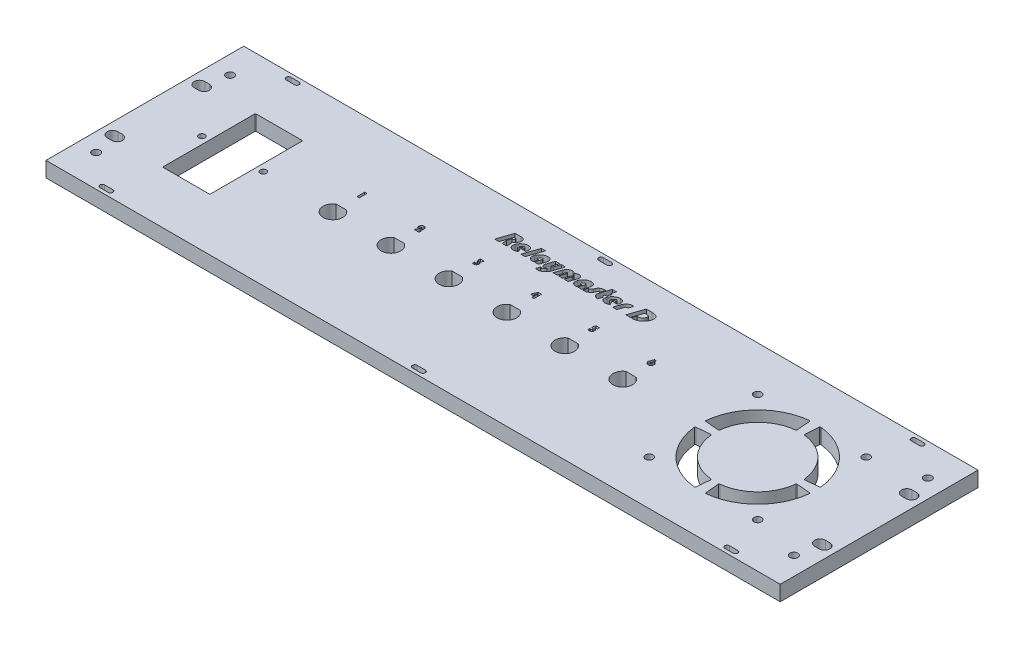
from build123d import *

# Parameters (mm, degrees)
SKETCH1_W           = 482.6
SKETCH1_H           = 130
SKETCH1_R           = 2.5527
BOSS_EXTRUDE1_DEPTH = 10
CUT_EXTRUDE2_DEPTH  = 407.159250458
SKETCH3_R           = 2
SKETCH3_W           = 31
SKETCH3_H           = 61
CUT_EXTRUDE3_DEPTH  = 407.159250576
FILLET1_R           = 0.5
SKETCH4_R           = 2.5
CUT_EXTRUDE4_DEPTH  = 407.159250576
FILLET2_R           = 0.5
CUT_EXTRUDE5_DEPTH  = 10
LPATTERN1_COUNT     = 6
LPATTERN1_PITCH     = 38.1
SKETCH6_W           = 1.458333334
SKETCH6_H           = 5
CUT_EXTRUDE6_DEPTH  = 407.159250576
CUT_EXTRUDE7_DEPTH  = 407.159250576
LPATTERN2_COUNT     = 2
LPATTERN2_PITCH     = 205.4
LPATTERN3_COUNT     = 2
LPATTERN3_PITCH     = 205.4


with BuildPart() as part:
    # Sketch1 → Boss-Extrude1 (new body)
    with BuildSketch(Plane(origin=(0, 0, 0), x_dir=(1, 0, 0), z_dir=(0, 1, 0))):
        with Locations((158.999180011, 3.013992786)):
            Rectangle(SKETCH1_W, SKETCH1_H)
        with Locations((-70.300819989, 47.013992786)):
            Circle(SKETCH1_R, mode=Mode.SUBTRACT)
        with Locations((-70.300819989, -40.986007214)):
            Circle(SKETCH1_R, mode=Mode.SUBTRACT)
        with Locations((388.299180011, -40.986007214)):
            Circle(SKETCH1_R, mode=Mode.SUBTRACT)
        with Locations((388.299180011, 47.013992786)):
            Circle(SKETCH1_R, mode=Mode.SUBTRACT)
        with BuildLine():
            Line((-75.000819989, 35.088992786), (-72.000819989, 35.088992786))
            ThreePointArc((-72.000819989, 35.088992786), (-68.500819989, 31.588992786), (-72.000819989, 28.088992786))
            Line((-72.000819989, 28.088992786), (-75.000819989, 28.088992786))
            ThreePointArc((-75.000819989, 28.088992786), (-78.500819989, 31.588992786), (-75.000819989, 35.088992786))
        make_face(mode=Mode.SUBTRACT)
        with BuildLine():
            Line((-75.000819989, -22.061007214), (-72.000819989, -22.061007214))
            ThreePointArc((-72.000819989, -22.061007214), (-68.500819989, -25.561007214), (-72.000819989, -29.061007214))
            Line((-72.000819989, -29.061007214), (-75.000819989, -29.061007214))
            ThreePointArc((-75.000819989, -29.061007214), (-78.500819989, -25.561007214), (-75.000819989, -22.061007214))
        make_face(mode=Mode.SUBTRACT)
        with BuildLine():
            Line((392.999180011, 28.088992786), (389.999180011, 28.088992786))
            ThreePointArc((389.999180011, 28.088992786), (386.499180011, 31.588992786), (389.999180011, 35.088992786))
            Line((389.999180011, 35.088992786), (392.999180011, 35.088992786))
            ThreePointArc((392.999180011, 35.088992786), (396.499180011, 31.588992786), (392.999180011, 28.088992786))
        make_face(mode=Mode.SUBTRACT)
        with BuildLine():
            Line((392.999180011, -29.061007214), (389.999180011, -29.061007214))
            ThreePointArc((389.999180011, -29.061007214), (386.499180011, -25.561007214), (389.999180011, -22.061007214))
            Line((389.999180011, -22.061007214), (392.999180011, -22.061007214))
            ThreePointArc((392.999180011, -22.061007214), (396.499180011, -25.561007214), (392.999180011, -29.061007214))
        make_face(mode=Mode.SUBTRACT)
    extrude(amount=BOSS_EXTRUDE1_DEPTH)

    # Sketch2 → Cut-Extrude2 (cut, through all)
    with BuildSketch(Plane(origin=(0, 10, 0), x_dir=(1, 0, 0), z_dir=(0, 1, 0))):
        with BuildLine():
            Line((115.335548963, 47.892597993), (112.88112188, 40.670375771))
            Line((112.88112188, 40.670375771), (109.964455213, 40.670375771))
            Line((109.964455213, 40.670375771), (113.362892713, 50.670375771))
            Line((113.362892713, 50.670375771), (117.238760769, 50.670375771))
            add(Edge.make_bspline(
                [(117.238760769, 50.670375771), (117.378488132, 50.66829828), (117.647033186, 50.664305505), (118.032383194, 50.622395907), (118.384034766, 50.556106218), (118.703397593, 50.463941844), (118.989470951, 50.342718773), (119.24243641, 50.19399272), (119.463573048, 50.018796041), (119.582453092, 49.878197324), (119.641104519, 49.808830632)],
                knots=[0, 0, 0, 0, 1.268946959, 2.438816719, 3.516291673, 4.516504795, 5.452755853, 6.33073326, 7.176439771, 8, 8, 8, 8], degree=3))
            add(Edge.make_bspline(
                [(119.641104519, 49.808830632), (119.699587482, 49.728059333), (119.815497833, 49.567974599), (119.940169757, 49.297913336), (120.030331769, 49.014477201), (120.080789399, 48.714181217), (120.087163726, 48.398352863), (120.058501635, 48.067327276), (119.990585038, 47.719606274), (119.917613523, 47.487590833), (119.879819797, 47.367424382)],
                knots=[0, 0, 0, 0, 0.932249006, 1.847671586, 2.771408984, 3.712800187, 4.689011787, 5.722820456, 6.820593216, 8, 8, 8, 8], degree=3))
            add(Edge.make_bspline(
                [(119.879819797, 47.367424382), (119.833154617, 47.242640155), (119.73998991, 46.993514658), (119.553958798, 46.637392928), (119.334324356, 46.296255789), (119.079127949, 45.968930566), (118.78594183, 45.657949303), (118.458228568, 45.360912296), (118.093564888, 45.0791406), (117.831047228, 44.908966444), (117.696660074, 44.821851465)],
                knots=[0, 0, 0, 0, 0.933827764, 1.864340643, 2.811651759, 3.77699005, 4.771445029, 5.806065946, 6.876888697, 8, 8, 8, 8], degree=3))
            Line((117.696660074, 44.821851465), (118.000479519, 40.670375771))
            Line((118.000479519, 40.670375771), (114.879819797, 40.670375771))
            Line((114.879819797, 40.670375771), (114.539107991, 43.91473341))
            Line((114.539107991, 43.91473341), (115.42018438, 46.503709104))
            Line((115.42018438, 46.503709104), (115.65455938, 46.503709104))
            add(Edge.make_bspline(
                [(115.65455938, 46.503709104), (115.734971548, 46.505495396), (115.889388907, 46.508925654), (116.109255254, 46.54293042), (116.305300414, 46.602372599), (116.479184767, 46.681114562), (116.62723646, 46.787460897), (116.750966962, 46.916259013), (116.85384571, 47.067291832), (116.897440132, 47.182563833), (116.919750352, 47.241556327)],
                knots=[0, 0, 0, 0, 1.223524833, 2.349563247, 3.373699419, 4.334298088, 5.241868773, 6.129650763, 7.042815567, 8, 8, 8, 8], degree=3))
            add(Edge.make_bspline(
                [(116.919750352, 47.241556327), (116.934777382, 47.291682787), (116.96261298, 47.384535466), (116.951585407, 47.524880574), (116.89732647, 47.646143738), (116.792814469, 47.740167427), (116.648948346, 47.811035287), (116.462837151, 47.857858322), (116.235649041, 47.887282053), (116.069892532, 47.890729859), (115.980080213, 47.892597993)],
                knots=[0, 0, 0, 0, 0.898624187, 1.664583208, 2.38131814, 3.142559736, 4.043707542, 5.133639638, 6.446911837, 8, 8, 8, 8], degree=3))
            Line((115.980080213, 47.892597993), (115.335548963, 47.892597993))
        make_face()
        with BuildLine():
            Line((127.08034063, 43.864820215), (122.928864935, 43.864820215))
            add(Edge.make_bspline(
                [(122.928864935, 43.864820215), (122.941416881, 43.962312226), (122.965754006, 44.151340708), (123.019854456, 44.334063129), (123.046052435, 44.42254591)],
                knots=[0, 0, 0, 0, 1.031506037, 2, 2, 2, 2], degree=3))
            add(Edge.make_bspline(
                [(123.046052435, 44.42254591), (123.090855315, 44.540828871), (123.182631693, 44.783125392), (123.320526452, 45.002525583), (123.391104519, 45.114820215)],
                knots=[0, 0, 0, 0, 0.976348819, 2, 2, 2, 2], degree=3))
            Line((123.391104519, 45.114820215), (124.782163547, 45.114820215))
            add(Edge.make_bspline(
                [(124.782163547, 45.114820215), (124.794125549, 45.190555028), (124.816364301, 45.331354834), (124.820854111, 45.531171801), (124.793971278, 45.701662984), (124.738371102, 45.844500806), (124.64770514, 45.956620204), (124.524334681, 46.034533211), (124.372169651, 46.079911288), (124.261662272, 46.084562352), (124.202736463, 46.087042438)],
                knots=[0, 0, 0, 0, 1.359693728, 2.52782843, 3.530177573, 4.404996503, 5.216909677, 6.042905647, 6.95641929, 8, 8, 8, 8], degree=3))
            add(Edge.make_bspline(
                [(124.202736463, 46.087042438), (124.118193946, 46.08130003), (123.946617115, 46.069645964), (123.694243041, 45.98197496), (123.450590766, 45.837939098), (123.215080686, 45.646292226), (122.997634436, 45.410280729), (122.806729307, 45.138945992), (122.641283655, 44.838221078), (122.560133535, 44.620494666), (122.518708685, 44.509351465)],
                knots=[0, 0, 0, 0, 0.827832751, 1.680064964, 2.58876647, 3.592266134, 4.646151931, 5.724523089, 6.838433137, 8, 8, 8, 8], degree=3))
            add(Edge.make_bspline(
                [(122.518708685, 44.509351465), (122.483339164, 44.39509878), (122.417212985, 44.18149415), (122.365590101, 43.868754192), (122.368927442, 43.589813158), (122.409068136, 43.379255472), (122.472460702, 43.236894832), (122.526284729, 43.143326768), (122.593203099, 43.065165826), (122.672675932, 43.002459843), (122.76097664, 42.95240462), (122.861064326, 42.91800648), (122.970519006, 42.895296046), (123.047374853, 42.893520178), (123.087285074, 42.892597993)],
                knots=[0, 0, 0, 0, 2.100659137, 3.927352035, 5.54202328, 6.985703129, 7.651739151, 8.273086743, 8.877024698, 9.446816915, 10.044433555, 10.651574031, 11.299780288, 12, 12, 12, 12], degree=3))
            add(Edge.make_bspline(
                [(123.087285074, 42.892597993), (123.157992575, 42.896846389), (123.305307183, 42.905697653), (123.527147225, 42.981170691), (123.761975886, 43.088670137), (123.912576788, 43.190369443), (123.992232991, 43.244160493)],
                knots=[0, 0, 0, 0, 0.859384503, 1.790473304, 2.831331656, 4, 4, 4, 4], degree=3))
            Line((123.992232991, 43.244160493), (124.918882297, 41.377841049))
            add(Edge.make_bspline(
                [(124.918882297, 41.377841049), (124.805303666, 41.310728523), (124.581406324, 41.178429727), (124.239470938, 41.005695243), (123.899490712, 40.858075685), (123.55930414, 40.741558557), (123.221125601, 40.647379427), (122.884034174, 40.579476505), (122.548630924, 40.539259758), (122.325670825, 40.534066996), (122.214889241, 40.531486882)],
                knots=[0, 0, 0, 0, 1.103083133, 2.174505721, 3.201645937, 4.200367129, 5.179341595, 6.135640026, 7.073660477, 8, 8, 8, 8], degree=3))
            add(Edge.make_bspline(
                [(122.214889241, 40.531486882), (122.08447934, 40.534542961), (121.831239059, 40.540477496), (121.46563732, 40.594130465), (121.126911628, 40.67645059), (120.81666703, 40.797954249), (120.532881795, 40.951084527), (120.278020994, 41.142371642), (120.053394583, 41.368839763), (119.856039792, 41.623968412), (119.693107858, 41.905425347), (119.571628364, 42.207548617), (119.487556662, 42.524586226), (119.448505815, 42.858099669), (119.442540147, 43.207624328), (119.485056147, 43.573147197), (119.562475159, 43.95478481), (119.643015599, 44.209077619), (119.684507297, 44.340080632)],
                knots=[0, 0, 0, 0, 1.131220035, 2.196692713, 3.200169955, 4.150382372, 5.080363814, 5.990725719, 6.905256434, 7.84081604, 8.783092785, 9.718125583, 10.65923029, 11.620967352, 12.625583103, 13.686384095, 14.808103719, 16, 16, 16, 16], degree=3))
            add(Edge.make_bspline(
                [(119.684507297, 44.340080632), (119.733155835, 44.472535163), (119.830125559, 44.736552946), (120.010903896, 45.11782135), (120.22536001, 45.480668303), (120.466831402, 45.828883941), (120.736861267, 46.162351996), (121.037639597, 46.479617852), (121.367860315, 46.781926048), (121.725988902, 47.062963718), (122.098942762, 47.320761063), (122.480157748, 47.54881461), (122.866600262, 47.739415146), (123.257139225, 47.897666728), (123.652283458, 48.019047922), (124.051420184, 48.106259338), (124.454426572, 48.160406735), (124.724851489, 48.167049081), (124.860288547, 48.170375771)],
                knots=[0, 0, 0, 0, 0.990392726, 1.974121168, 2.95757423, 3.946624651, 4.946878979, 5.967240611, 7.013379789, 8.087405977, 9.160939677, 10.194875671, 11.203387311, 12.183319209, 13.150466102, 14.101868051, 15.049357545, 16, 16, 16, 16], degree=3))
            add(Edge.make_bspline(
                [(124.860288547, 48.170375771), (124.989195588, 48.167003668), (125.23862877, 48.1604787), (125.599393998, 48.111487389), (125.931153197, 48.024075122), (126.236694853, 47.904867463), (126.513843985, 47.74969987), (126.765368016, 47.561719056), (126.985108142, 47.335554054), (127.175112098, 47.079561889), (127.334231451, 46.800275749), (127.453722842, 46.500766121), (127.535740598, 46.185138669), (127.572343683, 45.85303417), (127.575816123, 45.505771847), (127.533222764, 45.144147586), (127.458770539, 44.765643518), (127.378112369, 44.513715051), (127.336417019, 44.38348341)],
                knots=[0, 0, 0, 0, 1.131233226, 2.188919233, 3.186797597, 4.135858022, 5.059607904, 5.966224945, 6.882086875, 7.816638679, 8.757680654, 9.694945741, 10.638874518, 11.610640238, 12.620124796, 13.680208972, 14.800809634, 16, 16, 16, 16], degree=3))
            add(Edge.make_bspline(
                [(127.336417019, 44.38348341), (127.324471304, 44.352230352), (127.297152142, 44.280756408), (127.241258667, 44.163046447), (127.168061661, 44.021253826), (127.111065975, 43.919612967), (127.08034063, 43.864820215)],
                knots=[0, 0, 0, 0, 0.693176941, 1.585255743, 2.698254966, 4, 4, 4, 4], degree=3))
        make_face()
        Polygon((133.362892713, 50.670375771), (129.964455213, 40.670375771), (127.186677435, 40.670375771), (130.585114935, 50.670375771), align=None)
        with BuildLine():
            Line((136.457510769, 43.430792438), (135.487458685, 40.577059799))
            add(Edge.make_bspline(
                [(135.487458685, 40.577059799), (135.376921787, 40.563499792), (135.168596739, 40.537943718), (134.95877789, 40.533549525), (134.860288547, 40.531486882)],
                knots=[0, 0, 0, 0, 1.061196419, 2, 2, 2, 2], degree=3))
            add(Edge.make_bspline(
                [(134.860288547, 40.531486882), (134.727764931, 40.534833429), (134.471845778, 40.541296016), (134.101775461, 40.59043496), (133.761323697, 40.677711477), (133.448353472, 40.796934777), (133.162950569, 40.949536686), (132.906481501, 41.137322021), (132.68075858, 41.361871633), (132.486848438, 41.617307619), (132.325384425, 41.897723493), (132.203294986, 42.198508148), (132.122557852, 42.517663341), (132.08223896, 42.85300907), (132.080233177, 43.205447238), (132.121122706, 43.574076506), (132.201941594, 43.959771473), (132.283472842, 44.217743734), (132.325566324, 44.350931327)],
                knots=[0, 0, 0, 0, 1.144190407, 2.209570271, 3.21553817, 4.172569541, 5.094845463, 6.001870815, 6.907346212, 7.834348322, 8.763305581, 9.693584961, 10.628341389, 11.597586927, 12.603283284, 13.664902594, 14.794420756, 16, 16, 16, 16], degree=3))
            add(Edge.make_bspline(
                [(132.325566324, 44.350931327), (132.37398375, 44.482791321), (132.470273648, 44.745027187), (132.654095009, 45.121634423), (132.860458487, 45.486133354), (133.104678391, 45.831029956), (133.372661197, 46.163933582), (133.672890571, 46.479601096), (134.000019509, 46.78209882), (134.355989664, 47.062159765), (134.724998964, 47.321477753), (135.103475542, 47.548076548), (135.485817158, 47.739555998), (135.870951496, 47.896735612), (136.258486598, 48.019127059), (136.649023989, 48.106214447), (137.043366341, 48.160414346), (137.308035459, 48.167051724), (137.440583685, 48.170375771)],
                knots=[0, 0, 0, 0, 0.994917965, 1.97863784, 2.96618437, 3.960322707, 4.96997828, 5.992682734, 7.044876782, 8.124977746, 9.200176396, 10.239426291, 11.248235466, 12.227872304, 13.184528156, 14.124848425, 15.060910407, 16, 16, 16, 16], degree=3))
            add(Edge.make_bspline(
                [(137.440583685, 48.170375771), (137.583201753, 48.166841028), (137.857710374, 48.160037421), (138.252190324, 48.114078302), (138.61101029, 48.030477682), (138.937581704, 47.919787908), (139.2291217, 47.771177748), (139.485433798, 47.589607564), (139.709095397, 47.376806567), (139.892569309, 47.129765156), (140.042783005, 46.856699712), (140.147755803, 46.556447872), (140.216240252, 46.233436114), (140.240039977, 45.886931288), (140.225765332, 45.516894321), (140.172703802, 45.123891923), (140.078360059, 44.706527517), (139.987729028, 44.425502898), (139.940583685, 44.279316743)],
                knots=[0, 0, 0, 0, 1.196225853, 2.302473407, 3.323857472, 4.281343462, 5.187635444, 6.057979036, 6.907605345, 7.765509949, 8.628868004, 9.511642107, 10.423138458, 11.390568647, 12.416573448, 13.524350622, 14.712192315, 16, 16, 16, 16], degree=3))
            Line((139.940583685, 44.279316743), (138.714455213, 40.670375771))
            Line((138.714455213, 40.670375771), (135.936677435, 40.670375771))
            Line((135.936677435, 40.670375771), (137.095531602, 44.081834104))
            add(Edge.make_bspline(
                [(137.095531602, 44.081834104), (137.125372293, 44.175865751), (137.181071117, 44.35137952), (137.214182532, 44.608869329), (137.207476549, 44.837386602), (137.151188997, 45.034553405), (137.053506738, 45.19883364), (136.905887845, 45.31340088), (136.720887111, 45.38377354), (136.584807751, 45.389515743), (136.511764241, 45.392597993)],
                knots=[0, 0, 0, 0, 1.35465714, 2.52852086, 3.55473976, 4.477449583, 5.322396048, 6.136784919, 6.999879412, 8, 8, 8, 8], degree=3))
            add(Edge.make_bspline(
                [(136.511764241, 45.392597993), (136.440487272, 45.388725027), (136.295587453, 45.380851627), (136.080580816, 45.318593165), (135.867494597, 45.218862424), (135.662406979, 45.083372712), (135.471171907, 44.925914153), (135.313760861, 44.743956051), (135.183406645, 44.551882685), (135.128343188, 44.410058863), (135.101173963, 44.340080632)],
                knots=[0, 0, 0, 0, 0.917738553, 1.865681891, 2.862849718, 3.941460506, 5.026822724, 6.04444962, 7.03509894, 8, 8, 8, 8], degree=3))
            add(Edge.make_bspline(
                [(135.101173963, 44.340080632), (135.079429116, 44.269090589), (135.038522158, 44.135542317), (135.024703801, 43.936360387), (135.051527715, 43.755223054), (135.1245927, 43.597450478), (135.233579928, 43.464897699), (135.382697934, 43.375394635), (135.558300582, 43.316048654), (135.686559564, 43.311611255), (135.754385769, 43.30926466)],
                knots=[0, 0, 0, 0, 1.198022138, 2.253749655, 3.202377793, 4.129386931, 5.034563436, 5.934046712, 6.907477906, 8, 8, 8, 8], degree=3))
            add(Edge.make_bspline(
                [(135.754385769, 43.30926466), (135.873139025, 43.314497292), (136.112669262, 43.325051729), (136.34191798, 43.395347565), (136.457510769, 43.430792438)],
                knots=[0, 0, 0, 0, 0.991551279, 2, 2, 2, 2], degree=3))
        make_face()
        with BuildLine():
            Line((140.148917019, 37.532354938), (140.943187852, 39.869594521))
            add(Edge.make_bspline(
                [(140.943187852, 39.869594521), (141.02013581, 39.842699809), (141.169370442, 39.790539589), (141.393812069, 39.740560627), (141.607549569, 39.704647105), (141.747447398, 39.700280348), (141.815583685, 39.698153549)],
                knots=[0, 0, 0, 0, 1.094028368, 2.121783671, 3.0852275, 4, 4, 4, 4], degree=3))
            add(Edge.make_bspline(
                [(141.815583685, 39.698153549), (141.920143567, 39.701998741), (142.127157041, 39.709611665), (142.429761674, 39.780573707), (142.719904479, 39.891426296), (142.995136374, 40.05065303), (143.257970651, 40.253214536), (143.507164917, 40.499965332), (143.743703696, 40.791081659), (143.881619475, 41.008807831), (143.953170491, 41.12176466)],
                knots=[0, 0, 0, 0, 0.930598492, 1.842450686, 2.754758579, 3.690345955, 4.665181319, 5.704602894, 6.809142816, 8, 8, 8, 8], degree=3))
            add(Edge.make_bspline(
                [(143.953170491, 41.12176466), (143.814112857, 41.052953927), (143.549029445, 40.921781094), (143.149545971, 40.780536939), (142.77318422, 40.688423973), (142.527854899, 40.676225717), (142.410201741, 40.670375771)],
                knots=[0, 0, 0, 0, 1.146861305, 2.186243914, 3.130172742, 4, 4, 4, 4], degree=3))
            add(Edge.make_bspline(
                [(142.410201741, 40.670375771), (142.329806588, 40.673164719), (142.174025868, 40.678568831), (141.949637435, 40.711762823), (141.744805675, 40.773690165), (141.558672071, 40.858078556), (141.391462409, 40.967651362), (141.24461619, 41.102536624), (141.115161623, 41.259401746), (141.009579397, 41.44109676), (140.925549319, 41.640319772), (140.864200726, 41.854397294), (140.829559963, 42.08191437), (140.82295701, 42.321956916), (140.835065705, 42.574839567), (140.875593047, 42.840513324), (140.941108838, 43.11890367), (141.001173336, 43.306031987), (141.032163547, 43.402580632)],
                knots=[0, 0, 0, 0, 1.042971701, 2.020953713, 2.9322108, 3.809657486, 4.663202133, 5.513336514, 6.386710566, 7.291034154, 8.228574651, 9.184847823, 10.172102137, 11.204853161, 12.29467164, 13.451721446, 14.685218539, 16, 16, 16, 16], degree=3))
            Line((141.032163547, 43.402580632), (142.605514241, 48.031486882))
            Line((142.605514241, 48.031486882), (145.383292019, 48.031486882))
            Line((145.383292019, 48.031486882), (144.037805908, 44.073153549))
            add(Edge.make_bspline(
                [(144.037805908, 44.073153549), (144.023085095, 44.024955171), (143.995715082, 43.935341218), (143.971946886, 43.807975703), (143.971885102, 43.697374384), (143.997284272, 43.606051013), (144.045805577, 43.532456913), (144.118994198, 43.481030376), (144.214745234, 43.454216082), (144.284316705, 43.450287029), (144.322094102, 43.448153549)],
                knots=[0, 0, 0, 0, 1.413078495, 2.627299044, 3.621746679, 4.488562546, 5.2483103, 6.047925692, 6.940021184, 8, 8, 8, 8], degree=3))
            add(Edge.make_bspline(
                [(144.322094102, 43.448153549), (144.360668855, 43.450185893), (144.437069265, 43.454211114), (144.547256367, 43.488141488), (144.649092369, 43.543444552), (144.741541776, 43.621917787), (144.825589764, 43.720977848), (144.905177991, 43.839562972), (144.973493018, 43.982022227), (145.011654827, 44.085823883), (145.031729519, 44.140427854)],
                knots=[0, 0, 0, 0, 0.869551351, 1.722216603, 2.577381428, 3.470395431, 4.443063541, 5.50314562, 6.686551159, 8, 8, 8, 8], degree=3))
            Line((145.031729519, 44.140427854), (146.355514241, 48.031486882))
            Line((146.355514241, 48.031486882), (149.133292019, 48.031486882))
            Line((149.133292019, 48.031486882), (146.900219102, 41.460306327))
            add(Edge.make_bspline(
                [(146.900219102, 41.460306327), (146.846529409, 41.311936515), (146.740386668, 41.018614318), (146.547795979, 40.597051292), (146.333065007, 40.196534284), (146.093825937, 39.817893627), (145.830621309, 39.461002214), (145.54326396, 39.125383146), (145.230975839, 38.812174936), (145.005642705, 38.621653727), (144.89284063, 38.526278549)],
                knots=[0, 0, 0, 0, 1.050650266, 2.077100728, 3.083876355, 4.075771418, 5.057798155, 6.035120644, 7.016378708, 8, 8, 8, 8], degree=3))
            add(Edge.make_bspline(
                [(144.89284063, 38.526278549), (144.756023408, 38.420985437), (144.487833728, 38.214589449), (144.070813609, 37.94257526), (143.650947944, 37.714229619), (143.230002064, 37.525099336), (142.80635298, 37.379740057), (142.381812032, 37.274214479), (141.954882562, 37.211762244), (141.669658829, 37.202691726), (141.526955213, 37.198153549)],
                knots=[0, 0, 0, 0, 1.122840013, 2.200995601, 3.234956063, 4.229293297, 5.199609475, 6.14466215, 7.071734257, 8, 8, 8, 8], degree=3))
            add(Edge.make_bspline(
                [(141.526955213, 37.198153549), (141.404412037, 37.202354085), (141.162029915, 37.210662461), (140.807283842, 37.27584816), (140.46643697, 37.378300971), (140.254799821, 37.480982841), (140.148917019, 37.532354938)],
                knots=[0, 0, 0, 0, 1.026692551, 2.030728491, 3.014766614, 4, 4, 4, 4], degree=3))
        make_face()
        with BuildLine():
            Line((158.297788547, 40.670375771), (155.520010769, 40.670375771))
            Line((155.520010769, 40.670375771), (156.869837158, 44.643900077))
            add(Edge.make_bspline(
                [(156.869837158, 44.643900077), (156.890752793, 44.708769434), (156.928568197, 44.826053033), (156.971008238, 44.988029589), (156.986266286, 45.118552681), (156.987100273, 45.221531964), (156.957608846, 45.301254065), (156.900486246, 45.358409996), (156.816409596, 45.387340907), (156.754284388, 45.390731943), (156.720097574, 45.392597993)],
                knots=[0, 0, 0, 0, 1.748842243, 3.161901443, 4.282714784, 5.118485949, 5.776578054, 6.406334469, 7.123023523, 8, 8, 8, 8], degree=3))
            add(Edge.make_bspline(
                [(156.720097574, 45.392597993), (156.68500871, 45.390869356), (156.614263068, 45.387384103), (156.513404847, 45.347036512), (156.417609843, 45.287734638), (156.330460985, 45.201368133), (156.245513054, 45.095059054), (156.168010544, 44.963119272), (156.096691639, 44.807830463), (156.055887586, 44.694882144), (156.034333685, 44.635219521)],
                knots=[0, 0, 0, 0, 0.76938146, 1.551215389, 2.360681049, 3.240269051, 4.238683293, 5.354204105, 6.602412819, 8, 8, 8, 8], degree=3))
            Line((156.034333685, 44.635219521), (154.686677435, 40.670375771))
            Line((154.686677435, 40.670375771), (151.908899658, 40.670375771))
            Line((151.908899658, 40.670375771), (153.258726047, 44.643900077))
            add(Edge.make_bspline(
                [(153.258726047, 44.643900077), (153.2796784, 44.708765445), (153.317560192, 44.826041834), (153.359602428, 44.988061599), (153.375928708, 45.11850903), (153.374078302, 45.22209764), (153.341830196, 45.300753889), (153.284744356, 45.35912794), (153.199274759, 45.386897435), (153.136596371, 45.390588618), (153.102476047, 45.392597993)],
                knots=[0, 0, 0, 0, 1.743312146, 3.151903045, 4.269172209, 5.103326437, 5.766340049, 6.394105081, 7.125796652, 8, 8, 8, 8], degree=3))
            add(Edge.make_bspline(
                [(153.102476047, 45.392597993), (153.068092396, 45.39088703), (152.998714867, 45.387434738), (152.899603438, 45.346471978), (152.804405201, 45.287722273), (152.717069853, 45.202007064), (152.634718732, 45.094249043), (152.556727428, 44.963253216), (152.485631828, 44.807790515), (152.444794207, 44.694868336), (152.423222574, 44.635219521)],
                knots=[0, 0, 0, 0, 0.757373858, 1.528189294, 2.341787876, 3.225866826, 4.219478986, 5.340695358, 6.595277101, 8, 8, 8, 8], degree=3))
            Line((152.423222574, 44.635219521), (151.075566324, 40.670375771))
            Line((151.075566324, 40.670375771), (148.297788547, 40.670375771))
            Line((148.297788547, 40.670375771), (149.838587158, 45.20379591))
            add(Edge.make_bspline(
                [(149.838587158, 45.20379591), (149.876187575, 45.305660073), (149.950891659, 45.508042644), (150.08881248, 45.800892687), (150.250104723, 46.081138394), (150.432530847, 46.349943218), (150.635346567, 46.608295007), (150.862133246, 46.853028773), (151.10927862, 47.088165482), (151.377168463, 47.306223136), (151.653295203, 47.510151264), (151.937658229, 47.685370439), (152.223356779, 47.834364279), (152.510134361, 47.955741882), (152.79829978, 48.05362416), (153.089356707, 48.119310981), (153.381793623, 48.163528461), (153.577576306, 48.168094499), (153.675392713, 48.170375771)],
                knots=[0, 0, 0, 0, 1.013103043, 2.012821709, 3.016908165, 4.028119661, 5.042504246, 6.07937814, 7.139618998, 8.223669354, 9.301330298, 10.341211316, 11.337733066, 12.305831584, 13.245253476, 14.173865134, 15.087631509, 16, 16, 16, 16], degree=3))
            add(Edge.make_bspline(
                [(153.675392713, 48.170375771), (153.773262472, 48.167794328), (153.964448152, 48.162751557), (154.242259093, 48.113502056), (154.502096264, 48.034557281), (154.741440971, 47.919186787), (154.963301984, 47.774935668), (155.166072403, 47.597335562), (155.350748671, 47.38753613), (155.452631544, 47.227861557), (155.504819797, 47.146070215)],
                knots=[0, 0, 0, 0, 1.065504291, 2.08143111, 3.063685821, 4.01558644, 4.966572901, 5.938655121, 6.944101375, 8, 8, 8, 8], degree=3))
            add(Edge.make_bspline(
                [(155.504819797, 47.146070215), (155.620345523, 47.227780554), (155.844584869, 47.386383086), (156.185446942, 47.593366669), (156.513889557, 47.772035551), (156.833060336, 47.914434985), (157.139665376, 48.029759637), (157.436630561, 48.110748498), (157.723127157, 48.161282153), (157.911315402, 48.167404422), (158.002649658, 48.170375771)],
                knots=[0, 0, 0, 0, 1.238368342, 2.403714859, 3.488821346, 4.509228997, 5.460906033, 6.353438097, 7.200866636, 8, 8, 8, 8], degree=3))
            add(Edge.make_bspline(
                [(158.002649658, 48.170375771), (158.112062139, 48.16784948), (158.323336382, 48.16297124), (158.625818495, 48.114886739), (158.901271553, 48.036160059), (159.150999547, 47.9294907), (159.371021983, 47.785234715), (159.564762198, 47.612307366), (159.730132127, 47.406112529), (159.813523843, 47.249577073), (159.855948269, 47.169941743)],
                knots=[0, 0, 0, 0, 1.175481199, 2.26984069, 3.281386599, 4.249402272, 5.17686982, 6.096480107, 7.031609587, 8, 8, 8, 8], degree=3))
            add(Edge.make_bspline(
                [(159.855948269, 47.169941743), (159.885655299, 47.101982992), (159.946982723, 46.961688415), (159.997987703, 46.729515598), (160.024336671, 46.476918113), (160.019615026, 46.20212753), (159.992444823, 45.904898604), (159.930210086, 45.586605716), (159.846920743, 45.245468893), (159.771455358, 45.013813362), (159.732250352, 44.893466049)],
                knots=[0, 0, 0, 0, 0.760994326, 1.571002632, 2.430962691, 3.368121175, 4.391640095, 5.495931954, 6.699112165, 8, 8, 8, 8], degree=3))
            Line((159.732250352, 44.893466049), (158.297788547, 40.670375771))
        make_face()
        with BuildLine():
            Line((164.929732991, 43.430792438), (163.959680908, 40.577059799))
            add(Edge.make_bspline(
                [(163.959680908, 40.577059799), (163.84914401, 40.563499792), (163.640818961, 40.537943718), (163.431000112, 40.533549525), (163.332510769, 40.531486882)],
                knots=[0, 0, 0, 0, 1.061196419, 2, 2, 2, 2], degree=3))
            add(Edge.make_bspline(
                [(163.332510769, 40.531486882), (163.199987154, 40.534833429), (162.944068, 40.541296016), (162.573997683, 40.59043496), (162.233545919, 40.677711477), (161.920575694, 40.796934777), (161.635172791, 40.949536686), (161.378703723, 41.137322021), (161.152980803, 41.361871633), (160.95907066, 41.617307619), (160.797606647, 41.897723493), (160.675517209, 42.198508148), (160.594780074, 42.517663341), (160.554461182, 42.85300907), (160.5524554, 43.205447238), (160.593344928, 43.574076506), (160.674163816, 43.959771473), (160.755695064, 44.217743734), (160.797788547, 44.350931327)],
                knots=[0, 0, 0, 0, 1.144190407, 2.209570271, 3.21553817, 4.172569541, 5.094845463, 6.001870815, 6.907346212, 7.834348322, 8.763305581, 9.693584961, 10.628341389, 11.597586927, 12.603283284, 13.664902594, 14.794420756, 16, 16, 16, 16], degree=3))
            add(Edge.make_bspline(
                [(160.797788547, 44.350931327), (160.846205972, 44.482791321), (160.942495871, 44.745027187), (161.126317231, 45.121634423), (161.332680709, 45.486133354), (161.576900613, 45.831029956), (161.844883419, 46.163933582), (162.145112793, 46.479601096), (162.472241731, 46.78209882), (162.828211886, 47.062159765), (163.197221187, 47.321477753), (163.575697764, 47.548076548), (163.958039381, 47.739555998), (164.343173718, 47.896735612), (164.73070882, 48.019127059), (165.121246212, 48.106214447), (165.515588563, 48.160414346), (165.780257682, 48.167051724), (165.912805908, 48.170375771)],
                knots=[0, 0, 0, 0, 0.994917965, 1.97863784, 2.96618437, 3.960322707, 4.96997828, 5.992682734, 7.044876782, 8.124977746, 9.200176396, 10.239426291, 11.248235466, 12.227872304, 13.184528156, 14.124848425, 15.060910407, 16, 16, 16, 16], degree=3))
            add(Edge.make_bspline(
                [(165.912805908, 48.170375771), (166.055423975, 48.166841028), (166.329932596, 48.160037421), (166.724412546, 48.114078302), (167.083232512, 48.030477682), (167.409803926, 47.919787908), (167.701343922, 47.771177748), (167.95765602, 47.589607564), (168.181317619, 47.376806567), (168.364791532, 47.129765156), (168.515005228, 46.856699712), (168.619978025, 46.556447872), (168.688462474, 46.233436114), (168.712262199, 45.886931288), (168.697987554, 45.516894321), (168.644926024, 45.123891923), (168.550582281, 44.706527517), (168.45995125, 44.425502898), (168.412805908, 44.279316743)],
                knots=[0, 0, 0, 0, 1.196225853, 2.302473407, 3.323857472, 4.281343462, 5.187635444, 6.057979036, 6.907605345, 7.765509949, 8.628868004, 9.511642107, 10.423138458, 11.390568647, 12.416573448, 13.524350622, 14.712192315, 16, 16, 16, 16], degree=3))
            Line((168.412805908, 44.279316743), (167.186677435, 40.670375771))
            Line((167.186677435, 40.670375771), (164.408899658, 40.670375771))
            Line((164.408899658, 40.670375771), (165.567753824, 44.081834104))
            add(Edge.make_bspline(
                [(165.567753824, 44.081834104), (165.597594515, 44.175865751), (165.653293339, 44.35137952), (165.686404754, 44.608869329), (165.679698771, 44.837386602), (165.623411219, 45.034553405), (165.52572896, 45.19883364), (165.378110067, 45.31340088), (165.193109333, 45.38377354), (165.057029973, 45.389515743), (164.983986463, 45.392597993)],
                knots=[0, 0, 0, 0, 1.35465714, 2.52852086, 3.55473976, 4.477449583, 5.322396048, 6.136784919, 6.999879412, 8, 8, 8, 8], degree=3))
            add(Edge.make_bspline(
                [(164.983986463, 45.392597993), (164.912709494, 45.388725027), (164.767809675, 45.380851627), (164.552803038, 45.318593165), (164.339716819, 45.218862424), (164.134629201, 45.083372712), (163.943394129, 44.925914153), (163.785983084, 44.743956051), (163.655628867, 44.551882685), (163.60056541, 44.410058863), (163.573396185, 44.340080632)],
                knots=[0, 0, 0, 0, 0.917738553, 1.865681891, 2.862849718, 3.941460506, 5.026822724, 6.04444962, 7.03509894, 8, 8, 8, 8], degree=3))
            add(Edge.make_bspline(
                [(163.573396185, 44.340080632), (163.551651338, 44.269090589), (163.51074438, 44.135542317), (163.496926023, 43.936360387), (163.523749937, 43.755223054), (163.596814922, 43.597450478), (163.70580215, 43.464897699), (163.854920156, 43.375394635), (164.030522804, 43.316048654), (164.158781786, 43.311611255), (164.226607991, 43.30926466)],
                knots=[0, 0, 0, 0, 1.198022138, 2.253749655, 3.202377793, 4.129386931, 5.034563436, 5.934046712, 6.907477906, 8, 8, 8, 8], degree=3))
            add(Edge.make_bspline(
                [(164.226607991, 43.30926466), (164.345361247, 43.314497292), (164.584891484, 43.325051729), (164.814140203, 43.395347565), (164.929732991, 43.430792438)],
                knots=[0, 0, 0, 0, 0.991551279, 2, 2, 2, 2], degree=3))
        make_face()
        with BuildLine():
            Line((175.75221563, 47.892597993), (174.782163547, 45.041035493))
            add(Edge.make_bspline(
                [(174.782163547, 45.041035493), (174.691535454, 45.039163626), (174.521493623, 45.035651517), (174.284215281, 44.993839664), (174.08079003, 44.929202488), (173.90718541, 44.828740709), (173.757928172, 44.683926678), (173.618306368, 44.493091232), (173.476623556, 44.252719279), (173.39426509, 44.069770727), (173.34987188, 43.971157021)],
                knots=[0, 0, 0, 0, 1.119399073, 2.100283277, 2.968675404, 3.746469813, 4.556464414, 5.520730625, 6.663613678, 8, 8, 8, 8], degree=3))
            add(Edge.make_bspline(
                [(173.34987188, 43.971157021), (173.272338497, 43.799782325), (173.120651822, 43.464504061), (172.850517133, 42.994008614), (172.558365061, 42.560316919), (172.238329253, 42.16575805), (171.892302584, 41.809908376), (171.518406343, 41.493815724), (171.120291732, 41.213172039), (170.834239401, 41.061003369), (170.691451741, 40.98504591)],
                knots=[0, 0, 0, 0, 1.105028626, 2.161883212, 3.18431722, 4.175727407, 5.143889537, 6.097148449, 7.050160794, 8, 8, 8, 8], degree=3))
            add(Edge.make_bspline(
                [(170.691451741, 40.98504591), (170.612419832, 40.94830257), (170.451803003, 40.87362895), (170.196226056, 40.78412119), (169.926746721, 40.705836468), (169.642119403, 40.640585584), (169.342069444, 40.590854573), (169.026114501, 40.557212416), (168.695258752, 40.534447755), (168.469269456, 40.532485778), (168.354212158, 40.531486882)],
                knots=[0, 0, 0, 0, 0.870732372, 1.769592501, 2.70323275, 3.674987363, 4.686600388, 5.741428585, 6.850099853, 8, 8, 8, 8], degree=3))
            Line((168.354212158, 40.531486882), (167.972267713, 40.531486882))
            Line((167.972267713, 40.531486882), (168.964021185, 43.448153549))
            Line((168.964021185, 43.448153549), (169.087719102, 43.448153549))
            add(Edge.make_bspline(
                [(169.087719102, 43.448153549), (169.192109346, 43.451269202), (169.389919548, 43.457173086), (169.669442979, 43.506783308), (169.914356329, 43.589814943), (170.127168872, 43.714319749), (170.315413135, 43.881696242), (170.484329628, 44.098969213), (170.640104085, 44.366340995), (170.727564856, 44.566194304), (170.773917019, 44.672111882)],
                knots=[0, 0, 0, 0, 1.11106814, 2.105375046, 3.011751154, 3.850766066, 4.713186862, 5.678110215, 6.769452727, 8, 8, 8, 8], degree=3))
            add(Edge.make_bspline(
                [(170.773917019, 44.672111882), (170.809033582, 44.761222305), (170.876610103, 44.932701854), (170.979523071, 45.178286022), (171.075465067, 45.404406064), (171.172697599, 45.607684349), (171.260088834, 45.793697124), (171.347467334, 45.956932051), (171.426440027, 46.101905623), (171.533339373, 46.267297491), (171.682608451, 46.461445128), (171.894541227, 46.684001071), (172.143517034, 46.906796603), (172.328760499, 47.045502505), (172.425392713, 47.11785841)],
                knots=[0, 0, 0, 0, 1.146771218, 2.206787996, 3.188276572, 4.087223389, 4.904609345, 5.648478036, 6.303828441, 6.88044313, 8.004752368, 9.230203983, 10.555136488, 12, 12, 12, 12], degree=3))
            add(Edge.make_bspline(
                [(172.425392713, 47.11785841), (172.515491389, 47.18029104), (172.694007174, 47.303991081), (172.979926968, 47.459869577), (173.274774202, 47.596235537), (173.583527149, 47.7033242), (173.902518785, 47.788956467), (174.232624665, 47.849772102), (174.574545029, 47.884171801), (174.80596044, 47.889764219), (174.923222574, 47.892597993)],
                knots=[0, 0, 0, 0, 0.98842492, 1.958402261, 2.933985441, 3.916617661, 4.902993091, 5.911810608, 6.941878838, 8, 8, 8, 8], degree=3))
            Line((174.923222574, 47.892597993), (175.75221563, 47.892597993))
        make_face()
        with BuildLine():
            Line((180.02955938, 50.670375771), (179.085548963, 47.892597993))
            Line((179.085548963, 47.892597993), (180.196660074, 47.892597993))
            Line((180.196660074, 47.892597993), (179.204906602, 44.975931327))
            Line((179.204906602, 44.975931327), (178.093795491, 44.975931327))
            add(Edge.make_bspline(
                [(178.093795491, 44.975931327), (178.070694343, 44.905968736), (178.026901033, 44.773339253), (177.974710993, 44.580538993), (177.934486694, 44.405594132), (177.910371813, 44.245943836), (177.898974137, 44.103754706), (177.899721558, 43.977790681), (177.915878377, 43.868250337), (177.949171142, 43.77403808), (177.997287566, 43.692711593), (178.066616962, 43.626890732), (178.148519467, 43.566905923), (178.251452347, 43.523164458), (178.369356661, 43.484495265), (178.506449807, 43.464558707), (178.658900726, 43.44432316), (178.766447341, 43.443988914), (178.822962158, 43.443813271)],
                knots=[0, 0, 0, 0, 1.598754782, 3.03079146, 4.333491572, 5.492511037, 6.531663101, 7.426686025, 8.221657396, 8.921837668, 9.584210452, 10.250294036, 10.982144482, 11.776029931, 12.664834944, 13.668882151, 14.775017738, 16, 16, 16, 16], degree=3))
            Line((178.822962158, 43.443813271), (177.846399658, 40.570549382))
            add(Edge.make_bspline(
                [(177.846399658, 40.570549382), (177.811748747, 40.564233066), (177.746979638, 40.552426676), (177.656804338, 40.543812369), (177.582616715, 40.532611735), (177.538269922, 40.531831182), (177.518708685, 40.531486882)],
                knots=[0, 0, 0, 0, 1.278800772, 2.390320591, 3.289975278, 4, 4, 4, 4], degree=3))
            add(Edge.make_bspline(
                [(177.518708685, 40.531486882), (177.441959676, 40.532416986), (177.291033471, 40.534246028), (177.06956434, 40.558170063), (176.855880726, 40.588614478), (176.651059476, 40.637836266), (176.452485763, 40.697696859), (176.263081912, 40.774099697), (176.080208874, 40.861012034), (175.90827083, 40.963145515), (175.745112255, 41.074554579), (175.596809516, 41.200249982), (175.460085516, 41.333535655), (175.338105488, 41.477989264), (175.229312972, 41.630425827), (175.132540679, 41.791481794), (175.052356464, 41.964572328), (175.008442515, 42.084969693), (174.986156602, 42.146070215)],
                knots=[0, 0, 0, 0, 1.14390857, 2.24948543, 3.31894963, 4.360354346, 5.387413571, 6.40901995, 7.40291345, 8.403807109, 9.388289641, 10.3454434, 11.298942958, 12.232649643, 13.160605769, 14.089313989, 15.030344949, 16, 16, 16, 16], degree=3))
            add(Edge.make_bspline(
                [(174.986156602, 42.146070215), (174.963433641, 42.228140378), (174.916697464, 42.396940816), (174.878680447, 42.665654969), (174.869199183, 42.953464617), (174.884923383, 43.259750201), (174.927690582, 43.585168802), (174.994596343, 43.929750045), (175.09213909, 44.293342785), (175.171018177, 44.540056681), (175.211851047, 44.667771604)],
                knots=[0, 0, 0, 0, 0.79382568, 1.632726416, 2.52416093, 3.476864566, 4.490526111, 5.583733703, 6.749185725, 8, 8, 8, 8], degree=3))
            Line((175.211851047, 44.667771604), (177.251781602, 50.670375771))
            Line((177.251781602, 50.670375771), (180.02955938, 50.670375771))
        make_face()
        with BuildLine():
            Line((187.358118408, 43.864820215), (183.206642713, 43.864820215))
            add(Edge.make_bspline(
                [(183.206642713, 43.864820215), (183.219194659, 43.962312226), (183.243531784, 44.151340708), (183.297632234, 44.334063129), (183.323830213, 44.42254591)],
                knots=[0, 0, 0, 0, 1.031506037, 2, 2, 2, 2], degree=3))
            add(Edge.make_bspline(
                [(183.323830213, 44.42254591), (183.368633093, 44.540828871), (183.460409471, 44.783125392), (183.59830423, 45.002525583), (183.668882297, 45.114820215)],
                knots=[0, 0, 0, 0, 0.976348819, 2, 2, 2, 2], degree=3))
            Line((183.668882297, 45.114820215), (185.059941324, 45.114820215))
            add(Edge.make_bspline(
                [(185.059941324, 45.114820215), (185.071903327, 45.190555028), (185.094142079, 45.331354834), (185.098631889, 45.531171801), (185.071749056, 45.701662984), (185.01614888, 45.844500806), (184.925482918, 45.956620204), (184.802112458, 46.034533211), (184.649947429, 46.079911288), (184.53944005, 46.084562352), (184.480514241, 46.087042438)],
                knots=[0, 0, 0, 0, 1.359693728, 2.52782843, 3.530177573, 4.404996503, 5.216909677, 6.042905647, 6.95641929, 8, 8, 8, 8], degree=3))
            add(Edge.make_bspline(
                [(184.480514241, 46.087042438), (184.395971724, 46.08130003), (184.224394893, 46.069645964), (183.972020819, 45.98197496), (183.728368544, 45.837939098), (183.492858464, 45.646292226), (183.275412214, 45.410280729), (183.084507085, 45.138945992), (182.919061433, 44.838221078), (182.837911313, 44.620494666), (182.796486463, 44.509351465)],
                knots=[0, 0, 0, 0, 0.827832751, 1.680064964, 2.58876647, 3.592266134, 4.646151931, 5.724523089, 6.838433137, 8, 8, 8, 8], degree=3))
            add(Edge.make_bspline(
                [(182.796486463, 44.509351465), (182.761116942, 44.39509878), (182.694990763, 44.18149415), (182.643367879, 43.868754192), (182.646705219, 43.589813158), (182.686845914, 43.379255472), (182.75023848, 43.236894832), (182.804062507, 43.143326768), (182.870980876, 43.065165826), (182.95045371, 43.002459843), (183.038754418, 42.95240462), (183.138842103, 42.91800648), (183.248296784, 42.895296046), (183.325152631, 42.893520178), (183.365062852, 42.892597993)],
                knots=[0, 0, 0, 0, 2.100659137, 3.927352035, 5.54202328, 6.985703129, 7.651739151, 8.273086743, 8.877024698, 9.446816915, 10.044433555, 10.651574031, 11.299780288, 12, 12, 12, 12], degree=3))
            add(Edge.make_bspline(
                [(183.365062852, 42.892597993), (183.435770352, 42.896846389), (183.583084961, 42.905697653), (183.804925003, 42.981170691), (184.039753664, 43.088670137), (184.190354566, 43.190369443), (184.270010769, 43.244160493)],
                knots=[0, 0, 0, 0, 0.859384503, 1.790473304, 2.831331656, 4, 4, 4, 4], degree=3))
            Line((184.270010769, 43.244160493), (185.196660074, 41.377841049))
            add(Edge.make_bspline(
                [(185.196660074, 41.377841049), (185.083081444, 41.310728523), (184.859184102, 41.178429727), (184.517248716, 41.005695243), (184.17726849, 40.858075685), (183.837081918, 40.741558557), (183.498903379, 40.647379427), (183.161811952, 40.579476505), (182.826408702, 40.539259758), (182.603448603, 40.534066996), (182.492667019, 40.531486882)],
                knots=[0, 0, 0, 0, 1.103083133, 2.174505721, 3.201645937, 4.200367129, 5.179341595, 6.135640026, 7.073660477, 8, 8, 8, 8], degree=3))
            add(Edge.make_bspline(
                [(182.492667019, 40.531486882), (182.362257118, 40.534542961), (182.109016836, 40.540477496), (181.743415098, 40.594130465), (181.404689406, 40.67645059), (181.094444808, 40.797954249), (180.810659573, 40.951084527), (180.555798771, 41.142371642), (180.331172361, 41.368839763), (180.13381757, 41.623968412), (179.970885636, 41.905425347), (179.849406142, 42.207548617), (179.765334439, 42.524586226), (179.726283593, 42.858099669), (179.720317925, 43.207624328), (179.762833925, 43.573147197), (179.840252937, 43.95478481), (179.920793377, 44.209077619), (179.962285074, 44.340080632)],
                knots=[0, 0, 0, 0, 1.131220035, 2.196692713, 3.200169955, 4.150382372, 5.080363814, 5.990725719, 6.905256434, 7.84081604, 8.783092785, 9.718125583, 10.65923029, 11.620967352, 12.625583103, 13.686384095, 14.808103719, 16, 16, 16, 16], degree=3))
            add(Edge.make_bspline(
                [(179.962285074, 44.340080632), (180.010933613, 44.472535163), (180.107903337, 44.736552946), (180.288681674, 45.11782135), (180.503137788, 45.480668303), (180.74460918, 45.828883941), (181.014639045, 46.162351996), (181.315417375, 46.479617852), (181.645638093, 46.781926048), (182.00376668, 47.062963718), (182.37672054, 47.320761063), (182.757935525, 47.54881461), (183.14437804, 47.739415146), (183.534917002, 47.897666728), (183.930061236, 48.019047922), (184.329197962, 48.106259338), (184.73220435, 48.160406735), (185.002629267, 48.167049081), (185.138066324, 48.170375771)],
                knots=[0, 0, 0, 0, 0.990392726, 1.974121168, 2.95757423, 3.946624651, 4.946878979, 5.967240611, 7.013379789, 8.087405977, 9.160939677, 10.194875671, 11.203387311, 12.183319209, 13.150466102, 14.101868051, 15.049357545, 16, 16, 16, 16], degree=3))
            add(Edge.make_bspline(
                [(185.138066324, 48.170375771), (185.266973366, 48.167003668), (185.516406548, 48.1604787), (185.877171775, 48.111487389), (186.208930975, 48.024075122), (186.514472631, 47.904867463), (186.791621763, 47.74969987), (187.043145793, 47.561719056), (187.26288592, 47.335554054), (187.452889876, 47.079561889), (187.612009229, 46.800275749), (187.73150062, 46.500766121), (187.813518376, 46.185138669), (187.850121461, 45.85303417), (187.8535939, 45.505771847), (187.811000542, 45.144147586), (187.736548317, 44.765643518), (187.655890147, 44.513715051), (187.614194797, 44.38348341)],
                knots=[0, 0, 0, 0, 1.131233226, 2.188919233, 3.186797597, 4.135858022, 5.059607904, 5.966224945, 6.882086875, 7.816638679, 8.757680654, 9.694945741, 10.638874518, 11.610640238, 12.620124796, 13.680208972, 14.800809634, 16, 16, 16, 16], degree=3))
            add(Edge.make_bspline(
                [(187.614194797, 44.38348341), (187.602249082, 44.352230352), (187.57492992, 44.280756408), (187.519036445, 44.163046447), (187.445839438, 44.021253826), (187.388843753, 43.919612967), (187.358118408, 43.864820215)],
                knots=[0, 0, 0, 0, 0.693176941, 1.585255743, 2.698254966, 4, 4, 4, 4], degree=3))
        make_face()
        with BuildLine():
            Line((194.018274658, 48.103101465), (193.015670491, 45.151712577))
            add(Edge.make_bspline(
                [(193.015670491, 45.151712577), (192.935520246, 45.181170048), (192.781146432, 45.237906771), (192.617109548, 45.248578225), (192.538239935, 45.253709104)],
                knots=[0, 0, 0, 0, 1.038391726, 2, 2, 2, 2], degree=3))
            add(Edge.make_bspline(
                [(192.538239935, 45.253709104), (192.47859597, 45.250259929), (192.360775905, 45.243446464), (192.189091856, 45.1919662), (192.031323288, 45.102177424), (191.884470037, 44.981117653), (191.750202331, 44.825311891), (191.630667557, 44.634695622), (191.5184537, 44.412150904), (191.46001019, 44.248254471), (191.429298963, 44.162129243)],
                knots=[0, 0, 0, 0, 0.857727879, 1.694346698, 2.551821821, 3.454253235, 4.420876919, 5.498016402, 6.685243464, 8, 8, 8, 8], degree=3))
            Line((191.429298963, 44.162129243), (190.242232991, 40.670375771))
            Line((190.242232991, 40.670375771), (187.464455213, 40.670375771))
            Line((187.464455213, 40.670375771), (188.831642713, 44.693813271))
            add(Edge.make_bspline(
                [(188.831642713, 44.693813271), (188.878462324, 44.823221735), (188.970897882, 45.078711764), (189.136622647, 45.446573119), (189.323683505, 45.794207419), (189.529512415, 46.12252589), (189.756186845, 46.430451469), (190.004416726, 46.716942828), (190.271219621, 46.98479767), (190.557738097, 47.229187571), (190.857199926, 47.450360788), (191.168788649, 47.640953269), (191.486745423, 47.806450823), (191.815243835, 47.937576073), (192.150088804, 48.043104486), (192.493627518, 48.117182704), (192.845248993, 48.16112839), (193.082821956, 48.167281328), (193.202302435, 48.170375771)],
                knots=[0, 0, 0, 0, 1.106368822, 2.184294552, 3.240961959, 4.278726181, 5.297917302, 6.312499573, 7.324376687, 8.335166364, 9.338091685, 10.314830193, 11.269634832, 12.216985574, 13.155327909, 14.089785499, 15.039312627, 16, 16, 16, 16], degree=3))
            add(Edge.make_bspline(
                [(193.202302435, 48.170375771), (193.259472758, 48.169459153), (193.381897494, 48.167496305), (193.575010376, 48.152857634), (193.790198982, 48.134508636), (193.939505908, 48.113948319), (194.018274658, 48.103101465)],
                knots=[0, 0, 0, 0, 0.837281348, 1.792957316, 2.835646834, 4, 4, 4, 4], degree=3))
        make_face()
        with BuildLine():
            Line((201.537805908, 47.753709104), (199.13112188, 40.670375771))
            Line((199.13112188, 40.670375771), (196.214455213, 40.670375771))
            Line((196.214455213, 40.670375771), (199.612892713, 50.670375771))
            Line((199.612892713, 50.670375771), (203.501781602, 50.670375771))
            add(Edge.make_bspline(
                [(203.501781602, 50.670375771), (203.705890883, 50.667410072), (204.099698129, 50.66168807), (204.667195111, 50.607860531), (205.187774709, 50.516287195), (205.664026156, 50.396270909), (206.092246352, 50.232177466), (206.475366821, 50.035388097), (206.813400762, 49.801083692), (207.002543988, 49.612778014), (207.095531602, 49.52020216)],
                knots=[0, 0, 0, 0, 1.262400789, 2.435668661, 3.521533576, 4.529833824, 5.468912648, 6.351548883, 7.189579565, 8, 8, 8, 8], degree=3))
            add(Edge.make_bspline(
                [(207.095531602, 49.52020216), (207.145835013, 49.462489623), (207.245625682, 49.348000911), (207.374693287, 49.161956126), (207.491165381, 48.970458029), (207.590378416, 48.77047146), (207.67622543, 48.56363855), (207.743390408, 48.348561153), (207.792315173, 48.125362187), (207.830242142, 47.895911629), (207.849722856, 47.657867941), (207.850161745, 47.41216555), (207.840585242, 47.158469331), (207.812049342, 46.897463759), (207.764406092, 46.630110705), (207.70772669, 46.35326118), (207.62791163, 46.070320427), (207.567019579, 45.879971967), (207.536069797, 45.783222993)],
                knots=[0, 0, 0, 0, 0.92729224, 1.839539534, 2.740252885, 3.642117744, 4.542532316, 5.45212116, 6.368907862, 7.310188441, 8.269148525, 9.259966963, 10.286754772, 11.345066242, 12.43913077, 13.577548513, 14.768733435, 16, 16, 16, 16], degree=3))
            add(Edge.make_bspline(
                [(207.536069797, 45.783222993), (207.468810721, 45.598301907), (207.335377186, 45.231441765), (207.085268323, 44.705374546), (206.800954374, 44.204344418), (206.477924023, 43.729654441), (206.120099525, 43.280093518), (205.724397742, 42.856640903), (205.292529197, 42.459179838), (204.825533003, 42.093095964), (204.336260527, 41.760670409), (203.832152531, 41.468371049), (203.316320242, 41.221933014), (202.789076822, 41.021887139), (202.250734947, 40.864550819), (201.701411518, 40.752117137), (201.140319074, 40.682082362), (200.762546177, 40.674299471), (200.572094102, 40.670375771)],
                knots=[0, 0, 0, 0, 1.025002003, 2.033474859, 3.031329343, 4.024665799, 5.022612856, 6.022857244, 7.042053989, 8.078301562, 9.112414259, 10.122436121, 11.11226105, 12.08827759, 13.058195726, 14.031916157, 15.007801637, 16, 16, 16, 16], degree=3))
            add(Edge.make_bspline(
                [(200.572094102, 40.670375771), (200.519286462, 40.669720058), (200.399917247, 40.668237851), (200.198062346, 40.66397688), (199.952824122, 40.655098109), (199.774197996, 40.646691461), (199.67799688, 40.642163965)],
                knots=[0, 0, 0, 0, 0.708401999, 1.601309761, 2.708158311, 4, 4, 4, 4], degree=3))
            Line((199.67799688, 40.642163965), (200.678430908, 43.587042438))
            Line((200.678430908, 43.587042438), (201.153691324, 43.587042438))
            add(Edge.make_bspline(
                [(201.153691324, 43.587042438), (201.25861197, 43.588922623), (201.464387802, 43.592610142), (201.766212186, 43.615209057), (202.052925212, 43.659753364), (202.325919893, 43.717390067), (202.583896614, 43.793704599), (202.82821065, 43.884355921), (203.058306835, 43.993057613), (203.271512305, 44.122088376), (203.474440209, 44.262469105), (203.658029143, 44.425119436), (203.830961652, 44.600641762), (203.987695676, 44.794868907), (204.128150749, 45.006529895), (204.257141816, 45.232830298), (204.370721134, 45.47663614), (204.431963032, 45.64813612), (204.46315313, 45.735479938)],
                knots=[0, 0, 0, 0, 1.182901754, 2.319968495, 3.408693191, 4.451556732, 5.463085763, 6.438535628, 7.386919423, 8.326744925, 9.245350731, 10.164390798, 11.087077793, 12.02062009, 12.9728178, 13.94789263, 14.954875144, 16, 16, 16, 16], degree=3))
            add(Edge.make_bspline(
                [(204.46315313, 45.735479938), (204.48920419, 45.816811622), (204.53893879, 45.972083564), (204.587536603, 46.201697128), (204.609941086, 46.415631153), (204.608553682, 46.613775572), (204.584000123, 46.797977375), (204.529147545, 46.965741575), (204.449741034, 47.118097695), (204.34680799, 47.255139443), (204.215569019, 47.373424319), (204.059850263, 47.475190311), (203.879633984, 47.562243399), (203.675049479, 47.63338739), (203.445018484, 47.686676713), (203.190337262, 47.724974805), (202.910501247, 47.748729358), (202.715517097, 47.752006275), (202.614194797, 47.753709104)],
                knots=[0, 0, 0, 0, 1.189655133, 2.271194361, 3.264307837, 4.181776193, 5.027237603, 5.843400222, 6.628007383, 7.412355427, 8.21868327, 9.077088756, 9.99688052, 11.001238973, 12.089383153, 13.28279142, 14.588019472, 16, 16, 16, 16], degree=3))
            Line((202.614194797, 47.753709104), (201.537805908, 47.753709104))
        make_face()
    extrude(amount=-CUT_EXTRUDE2_DEPTH, mode=Mode.SUBTRACT)

    # Sketch3 → Cut-Extrude3 (cut, through all)
    with BuildSketch(Plane(origin=(0, 10, 0), x_dir=(-1, 0, 0), z_dir=(0, 1, 0))):
        with Locations((44.82676289, -3.013992786)):
            Circle(SKETCH3_R)
        with Locations((4.42676289, -3.013992786)):
            Circle(SKETCH3_R)
        with Locations((24.62676289, -3.013992786)):
            Rectangle(SKETCH3_W, SKETCH3_H)
    extrude(amount=-CUT_EXTRUDE3_DEPTH, mode=Mode.SUBTRACT)

    # Fillet1
    fillet1_edges = [part.edges().sort_by_distance(p)[0] for p in [
        (-40.12676289, 5, 27.486007214),
        (-9.12676289, 5, 27.486007214),
        (-9.12676289, 5, -33.513992786),
        (-40.12676289, 5, -33.513992786),
    ]]
    fillet(fillet1_edges, radius=FILLET1_R)

    # Sketch4 → Cut-Extrude4 (cut, through all)
    with BuildSketch(Plane(origin=(0, 10, 0), x_dir=(1, 0, 0), z_dir=(0, 1, 0))):
        with Locations((284.838881974, 38.663992786)):
            Circle(SKETCH4_R)
        with Locations((356.138881974, 38.663992786)):
            Circle(SKETCH4_R)
        with Locations((356.138881974, -32.636007214)):
            Circle(SKETCH4_R)
        with Locations((284.838881974, -32.636007214)):
            Circle(SKETCH4_R)
        with BuildLine():
            Line((292.595430428, 5.454353583), (282.633483447, 6.325911011))
            ThreePointArc((282.633483447, 6.325911011), (293.618824289, 29.884050471), (317.17696375, 40.869391314))
            Line((317.17696375, 40.869391314), (318.048521177, 30.907444333))
            ThreePointArc((318.048521177, 30.907444333), (300.689892101, 22.812982659), (292.595430428, 5.454353583))
        make_face()
        with BuildLine():
            Line((292.595430428, 0.573631989), (282.633483447, -0.297925438))
            ThreePointArc((282.633483447, -0.297925438), (293.618824289, -23.856064899), (317.17696375, -34.841405741))
            Line((317.17696375, -34.841405741), (318.048521177, -24.87945876))
            ThreePointArc((318.048521177, -24.87945876), (300.689892101, -16.784997087), (292.595430428, 0.573631989))
        make_face()
        with BuildLine():
            Line((348.382333521, 0.573631989), (358.344280502, -0.297925438))
            ThreePointArc((358.344280502, -0.297925438), (347.358939659, -23.856064899), (323.800800199, -34.841405741))
            Line((323.800800199, -34.841405741), (322.929242771, -24.87945876))
            ThreePointArc((322.929242771, -24.87945876), (340.287871848, -16.784997087), (348.382333521, 0.573631989))
        make_face()
        with BuildLine():
            Line((348.382333521, 5.454353583), (358.344280502, 6.325911011))
            ThreePointArc((358.344280502, 6.325911011), (347.358939659, 29.884050471), (323.800800199, 40.869391314))
            Line((323.800800199, 40.869391314), (322.929242771, 30.907444333))
            ThreePointArc((322.929242771, 30.907444333), (340.287871848, 22.812982659), (348.382333521, 5.454353583))
        make_face()
    extrude(amount=-CUT_EXTRUDE4_DEPTH, mode=Mode.SUBTRACT)

    # Fillet2
    fillet2_edges = [part.edges().sort_by_distance(p)[0] for p in [
        (292.595430428, 5, -0.573631989),
        (282.633483447, 5, 0.297925438),
        (318.048521177, 5, 24.87945876),
        (317.17696375, 5, 34.841405741),
        (322.929242771, 5, 24.87945876),
        (323.800800199, 5, 34.841405741),
        (348.382333521, 5, -0.573631989),
        (358.344280502, 5, 0.297925438),
        (348.382333521, 5, -5.454353583),
        (358.344280502, 5, -6.325911011),
        (322.929242771, 5, -30.907444333),
        (323.800800199, 5, -40.869391314),
        (317.17696375, 5, -40.869391314),
        (318.048521177, 5, -30.907444333),
        (292.595430428, 5, -5.454353583),
        (282.633483447, 5, -6.325911011),
    ]]
    fillet(fillet2_edges, radius=FILLET2_R)

    # Sketch5 → Cut-Extrude5 (cut)
    with BuildSketch(Plane(origin=(0, 10, 0), x_dir=(1, 0, 0), z_dir=(0, 1, 0))):
        with BuildLine():
            Line((37.94417831, 8.488992786), (44.668760081, 8.488992786))
            ThreePointArc((44.668760081, 8.488992786), (41.306469196, -3.411007214), (37.94417831, 8.488992786))
        make_face()
    cut_extrude5 = extrude(amount=-CUT_EXTRUDE5_DEPTH, mode=Mode.SUBTRACT)

    # LPattern1: Cut-Extrude5 ×6
    with Locations(*[(i * LPATTERN1_PITCH, 0, 0) for i in range(1, LPATTERN1_COUNT)]):
        add(cut_extrude5, mode=Mode.SUBTRACT)

    # Sketch6 → Cut-Extrude6 (cut, through all)
    with BuildSketch(Plane(origin=(0, 10, 0), x_dir=(1, 0, 0), z_dir=(0, 1, 0))):
        with Locations((41.261172063, 22.167067417)):
            Rectangle(SKETCH6_W, SKETCH6_H)
        with BuildLine():
            Line((81.215810848, 21.125400751), (81.215810848, 19.667067417))
            Line((81.215810848, 19.667067417), (77.985559112, 19.667067417))
            Line((77.985559112, 19.667067417), (79.568675432, 22.704176792))
            Line((79.568675432, 22.704176792), (79.622928904, 22.808343459))
            add(Edge.make_bspline(
                [(79.622928904, 22.808343459), (79.641909501, 22.847770566), (79.678483017, 22.923742252), (79.684931273, 23.00773896), (79.688033071, 23.048143806)],
                knots=[0, 0, 0, 0, 1.037942136, 2, 2, 2, 2], degree=3))
            add(Edge.make_bspline(
                [(79.688033071, 23.048143806), (79.68690543, 23.071709771), (79.684783388, 23.116057216), (79.671438364, 23.178469091), (79.645676961, 23.230972949), (79.610441552, 23.274641572), (79.563862744, 23.308075789), (79.507895193, 23.331542484), (79.442068075, 23.345898894), (79.395145114, 23.347023109), (79.370107723, 23.347622973)],
                knots=[0, 0, 0, 0, 1.13049971, 2.127422954, 3.034810287, 3.909632665, 4.790620664, 5.753792056, 6.801457024, 8, 8, 8, 8], degree=3))
            add(Edge.make_bspline(
                [(79.370107723, 23.347622973), (79.35009152, 23.346277972), (79.310282691, 23.343602993), (79.252210574, 23.324723733), (79.199692183, 23.290810776), (79.152563872, 23.246511127), (79.112571786, 23.194339623), (79.084170847, 23.135565143), (79.065675188, 23.072768911), (79.063923483, 23.029105686), (79.063033071, 23.006911167)],
                knots=[0, 0, 0, 0, 0.946513618, 1.882454807, 2.850825095, 3.879716303, 4.930143304, 5.940085676, 6.952921871, 8, 8, 8, 8], degree=3))
            add(Edge.make_bspline(
                [(79.063033071, 23.006911167), (79.063852737, 22.981458343), (79.065479746, 22.930935425), (79.085345741, 22.857925922), (79.114331294, 22.787836356), (79.142897359, 22.746054925), (79.157434112, 22.724793112)],
                knots=[0, 0, 0, 0, 1.006630003, 1.998123399, 2.981281268, 4, 4, 4, 4], degree=3))
            Line((79.157434112, 22.724793112), (78.51724314, 21.572449362))
            add(Edge.make_bspline(
                [(78.51724314, 21.572449362), (78.451931732, 21.614851485), (78.32379629, 21.698040855), (78.155786818, 21.851039004), (78.008937094, 22.017889342), (77.888200418, 22.202761523), (77.792162799, 22.400638341), (77.723629115, 22.610091069), (77.682415671, 22.829879545), (77.676932301, 22.979607416), (77.674144182, 23.055739292)],
                knots=[0, 0, 0, 0, 1.044750095, 2.049711045, 3.04180433, 4.024448779, 5.00692496, 5.988980348, 6.977460263, 8, 8, 8, 8], degree=3))
            add(Edge.make_bspline(
                [(77.674144182, 23.055739292), (77.675504863, 23.114773194), (77.678195986, 23.231528994), (77.702548431, 23.403174276), (77.742989684, 23.568040646), (77.798554053, 23.726682369), (77.870260781, 23.878638983), (77.958138447, 24.024192293), (78.0611706, 24.163465723), (78.180307215, 24.293249761), (78.308900992, 24.413076814), (78.446642304, 24.518147851), (78.590992223, 24.607042805), (78.741706247, 24.68115148), (78.899861922, 24.735793738), (79.063970374, 24.776176304), (79.234722122, 24.80231076), (79.351204404, 24.804729913), (79.410255293, 24.805956306)],
                knots=[0, 0, 0, 0, 1.033286253, 2.043608158, 3.028234083, 4.001716342, 4.98197366, 5.96494833, 6.974495761, 8.010166636, 9.045450141, 10.048680303, 11.038243458, 12.009807848, 12.983290107, 13.961765827, 14.966713747, 16, 16, 16, 16], degree=3))
            add(Edge.make_bspline(
                [(79.410255293, 24.805956306), (79.469652586, 24.804627951), (79.586415239, 24.802016684), (79.758056427, 24.777473511), (79.922473974, 24.736948342), (80.081038441, 24.682345925), (80.230827561, 24.608038269), (80.37581395, 24.521470655), (80.51222534, 24.416145247), (80.641353583, 24.29805804), (80.759302367, 24.16854324), (80.862457424, 24.030242434), (80.951709615, 23.885725356), (81.021866575, 23.732588693), (81.077592919, 23.573486338), (81.11794174, 23.40749405), (81.142370482, 23.234423271), (81.145021855, 23.116582886), (81.146366404, 23.056824362)],
                knots=[0, 0, 0, 0, 1.038775824, 2.042015976, 3.02584825, 3.998545839, 4.969327105, 5.946092084, 6.948513598, 7.978675956, 9.004572774, 10.00823197, 10.993691085, 11.970476563, 12.949146148, 13.939125975, 14.95490166, 16, 16, 16, 16], degree=3))
            add(Edge.make_bspline(
                [(81.146366404, 23.056824362), (81.143967985, 22.988321718), (81.139230673, 22.853016551), (81.104579726, 22.653704542), (81.047902418, 22.461198348), (80.991328952, 22.340417338), (80.962989668, 22.279914639)],
                knots=[0, 0, 0, 0, 1.020263165, 2.015205106, 3.005758866, 4, 4, 4, 4], degree=3))
            Line((80.962989668, 22.279914639), (80.381392446, 21.125400751))
            Line((80.381392446, 21.125400751), (81.215810848, 21.125400751))
        make_face()
        with BuildLine():
            Line((116.482644147, 24.667067417), (119.130213591, 24.667067417))
            Line((119.130213591, 24.667067417), (118.314241369, 22.731303528))
            add(Edge.make_bspline(
                [(118.314241369, 22.731303528), (118.381213831, 22.682077712), (118.510493222, 22.58705532), (118.679396919, 22.426399764), (118.820343798, 22.259464429), (118.933456173, 22.083693338), (119.017996929, 21.895052307), (119.079259115, 21.692504523), (119.115052184, 21.473166708), (119.119333275, 21.321569027), (119.121533036, 21.24367332)],
                knots=[0, 0, 0, 0, 1.126019155, 2.173595955, 3.151834889, 4.082336179, 4.997527948, 5.945402467, 6.944282474, 8, 8, 8, 8], degree=3))
            add(Edge.make_bspline(
                [(119.121533036, 21.24367332), (119.119836577, 21.184627807), (119.116490649, 21.068172303), (119.090850801, 20.89728783), (119.049763618, 20.733118866), (118.991125, 20.576034769), (118.913921504, 20.427010104), (118.822917408, 20.283608178), (118.713021, 20.148570231), (118.588354444, 20.021831286), (118.451265787, 19.906504937), (118.305682604, 19.804695757), (118.151310487, 19.72012191), (117.990520084, 19.648846266), (117.821058902, 19.594145681), (117.643801112, 19.557406922), (117.459218508, 19.531883586), (117.333428947, 19.529429347), (117.269319494, 19.528178528)],
                knots=[0, 0, 0, 0, 1.006708943, 1.985532689, 2.940068517, 3.88876615, 4.837804663, 5.797766687, 6.780431635, 7.801160989, 8.825574424, 9.831754037, 10.825757839, 11.822895861, 12.827561568, 13.85597895, 14.90728599, 16, 16, 16, 16], degree=3))
            add(Edge.make_bspline(
                [(117.269319494, 19.528178528), (117.197191198, 19.530108015), (117.052871952, 19.533968664), (116.837734912, 19.570395972), (116.622591147, 19.622860627), (116.483584026, 19.67669931), (116.413199703, 19.703959778)],
                knots=[0, 0, 0, 0, 0.983488759, 1.967831794, 2.971039867, 4, 4, 4, 4], degree=3))
            Line((116.413199703, 19.703959778), (116.413199703, 21.112379917))
            add(Edge.make_bspline(
                [(116.413199703, 21.112379917), (116.465030957, 21.08255678), (116.562738872, 21.026336714), (116.710375365, 20.96558678), (116.846853709, 20.924791014), (116.935600406, 20.919541874), (116.977435814, 20.917067417)],
                knots=[0, 0, 0, 0, 1.187208015, 2.238024542, 3.169400501, 4, 4, 4, 4], degree=3))
            add(Edge.make_bspline(
                [(116.977435814, 20.917067417), (117.019614939, 20.919407939), (117.101772165, 20.923966848), (117.219858281, 20.95838115), (117.325760635, 21.017522084), (117.418786384, 21.09723948), (117.497035091, 21.192573659), (117.553043881, 21.302550583), (117.588341743, 21.42308578), (117.591919512, 21.507457181), (117.593755258, 21.550747973)],
                knots=[0, 0, 0, 0, 1.026602913, 1.999634851, 2.965781665, 3.95965143, 4.968251737, 5.949426676, 6.947855054, 8, 8, 8, 8], degree=3))
            add(Edge.make_bspline(
                [(117.593755258, 21.550747973), (117.592863399, 21.575750782), (117.59110814, 21.624958571), (117.579011468, 21.696729249), (117.559233702, 21.764757238), (117.532376277, 21.829333099), (117.496057276, 21.889253781), (117.451960103, 21.944974022), (117.400848408, 21.997652418), (117.320057637, 22.061291102), (117.203396157, 22.129242147), (117.043331159, 22.188717698), (116.861173118, 22.221041007), (116.733055857, 22.225498832), (116.666020883, 22.227831306)],
                knots=[0, 0, 0, 0, 0.69915107, 1.375992528, 2.029058809, 2.677249633, 3.326071606, 3.981718105, 4.661275389, 5.373764152, 6.851894338, 8.417075272, 10.125301256, 12, 12, 12, 12], degree=3))
            Line((116.666020883, 22.227831306), (117.036029564, 23.208734084))
            Line((117.036029564, 23.208734084), (116.482644147, 23.208734084))
            Line((116.482644147, 23.208734084), (116.482644147, 24.667067417))
        make_face()
        Polygon((156.772149932, 24.667067417), (156.772149932, 19.667067417), (155.383261043, 19.667067417), (155.383261043, 23.50929832), (154.728964168, 22.236511862), (155.036038821, 22.236511862), (155.036038821, 21.125400751), (153.083998891, 21.125400751), (154.564033613, 24.667067417), align=None)
        with BuildLine():
            Line((194.895670239, 24.667067417), (194.895670239, 23.208734084))
            Line((194.895670239, 23.208734084), (193.666286558, 23.208734084))
            Line((193.666286558, 23.208734084), (193.600097322, 22.983039639))
            add(Edge.make_bspline(
                [(193.600097322, 22.983039639), (193.65456486, 22.96668304), (193.760456665, 22.934883736), (193.91197925, 22.877639544), (194.053001456, 22.816648167), (194.182852597, 22.748685776), (194.302417274, 22.676754138), (194.410295345, 22.598027397), (194.507944444, 22.514838694), (194.564918873, 22.453370562), (194.592935864, 22.423143806)],
                knots=[0, 0, 0, 0, 1.181342289, 2.296679328, 3.363459451, 4.371887064, 5.339848978, 6.259825068, 7.144274593, 8, 8, 8, 8], degree=3))
            add(Edge.make_bspline(
                [(194.592935864, 22.423143806), (194.628086037, 22.381438422), (194.69784366, 22.298671591), (194.787923593, 22.164505449), (194.864141972, 22.02423772), (194.926500831, 21.87740213), (194.975140685, 21.724824382), (195.0101426, 21.565791373), (195.03113466, 21.400854606), (195.033408037, 21.288584091), (195.034559128, 21.231737556)],
                knots=[0, 0, 0, 0, 1.006188609, 1.996841518, 2.976704872, 3.948896158, 4.937026254, 5.928376308, 6.951063612, 8, 8, 8, 8], degree=3))
            add(Edge.make_bspline(
                [(195.034559128, 21.231737556), (195.032863313, 21.17161248), (195.029538289, 21.053723801), (195.004197294, 20.880855906), (194.961607592, 20.716216495), (194.902972797, 20.558764361), (194.826447274, 20.409156591), (194.732312305, 20.267727092), (194.622429133, 20.133660653), (194.496379143, 20.009728785), (194.358946293, 19.895696395), (194.209096813, 19.798675827), (194.052665256, 19.71376605), (193.885988412, 19.646761091), (193.711403123, 19.593473433), (193.527636533, 19.555573104), (193.335576433, 19.532386266), (193.204474481, 19.529596228), (193.137857739, 19.528178528)],
                knots=[0, 0, 0, 0, 1.012204368, 1.984653389, 2.934505543, 3.871183512, 4.808198041, 5.757542368, 6.726877526, 7.721727107, 8.73005775, 9.72840614, 10.722957382, 11.722772362, 12.747759296, 13.792940633, 14.878528492, 16, 16, 16, 16], degree=3))
            add(Edge.make_bspline(
                [(193.137857739, 19.528178528), (193.091887074, 19.528941075), (192.999728434, 19.530469772), (192.861947103, 19.54515778), (192.724844797, 19.568809429), (192.58850333, 19.603336572), (192.451936995, 19.645052147), (192.316085573, 19.697478858), (192.181149921, 19.759570654), (192.093056916, 19.806930586), (192.048448016, 19.830912903)],
                knots=[0, 0, 0, 0, 0.964705518, 1.933971331, 2.905079009, 3.88287121, 4.884283506, 5.900892089, 6.937045065, 8, 8, 8, 8], degree=3))
            Line((192.048448016, 19.830912903), (192.048448016, 21.053786167))
            add(Edge.make_bspline(
                [(192.048448016, 21.053786167), (192.116172755, 21.032858897), (192.246562457, 20.992567852), (192.43897773, 20.951050445), (192.618709883, 20.922538765), (192.734838068, 20.918843111), (192.790635516, 20.917067417)],
                knots=[0, 0, 0, 0, 1.122409743, 2.160963244, 3.116376795, 4, 4, 4, 4], degree=3))
            add(Edge.make_bspline(
                [(192.790635516, 20.917067417), (192.843227189, 20.918400208), (192.943049996, 20.920929942), (193.084130018, 20.948787743), (193.208389186, 20.992263615), (193.314061113, 21.05478335), (193.400425606, 21.131730026), (193.463360935, 21.224230569), (193.50049257, 21.330690335), (193.504644991, 21.405779108), (193.50678135, 21.444411167)],
                knots=[0, 0, 0, 0, 1.262469273, 2.396258208, 3.441283368, 4.411880414, 5.328824456, 6.199256787, 7.073544346, 8, 8, 8, 8], degree=3))
            add(Edge.make_bspline(
                [(193.50678135, 21.444411167), (193.506022554, 21.466903454), (193.504513959, 21.511621318), (193.490065962, 21.577261686), (193.465482787, 21.639161714), (193.433994267, 21.699468639), (193.390624745, 21.755358032), (193.339711118, 21.8102973), (193.278019152, 21.86084033), (193.18470024, 21.926598361), (193.052242366, 21.996971213), (192.875200451, 22.054533813), (192.681858698, 22.091646719), (192.547039133, 22.09558072), (192.477050447, 22.097622973)],
                knots=[0, 0, 0, 0, 0.602581929, 1.19801852, 1.7906046, 2.385092539, 3.015520995, 3.681080356, 4.390162102, 5.148973141, 6.741306754, 8.388321508, 10.125074569, 12, 12, 12, 12], degree=3))
            add(Edge.make_bspline(
                [(192.477050447, 22.097622973), (192.447009405, 22.097308756), (192.38247235, 22.096633725), (192.279437761, 22.086466287), (192.162848675, 22.073982709), (192.080961105, 22.061771659), (192.037597322, 22.055305264)],
                knots=[0, 0, 0, 0, 0.815502116, 1.751940064, 2.809533803, 4, 4, 4, 4], degree=3))
            Line((192.037597322, 22.055305264), (192.575791766, 24.667067417))
            Line((192.575791766, 24.667067417), (194.895670239, 24.667067417))
        make_face()
        with BuildLine():
            Line((231.206368939, 24.813551792), (232.520388036, 24.354567417))
            Line((232.520388036, 24.354567417), (231.51561373, 21.611511862))
            add(Edge.make_bspline(
                [(231.51561373, 21.611511862), (231.502630974, 21.574992537), (231.478485408, 21.507073235), (231.472710588, 21.435283013), (231.470040814, 21.402093459)],
                knots=[0, 0, 0, 0, 1.075373944, 2, 2, 2, 2], degree=3))
            add(Edge.make_bspline(
                [(231.470040814, 21.402093459), (231.47140783, 21.370005428), (231.474105666, 21.306678981), (231.50480795, 21.216524563), (231.549062164, 21.13161827), (231.61390239, 21.058624587), (231.688245755, 20.995107687), (231.773639328, 20.950381912), (231.865321005, 20.921477438), (231.929168398, 20.918552243), (231.961577272, 20.917067417)],
                knots=[0, 0, 0, 0, 1.001691293, 1.976860225, 2.95577767, 3.984931516, 5.015457984, 6.004366974, 6.987018633, 8, 8, 8, 8], degree=3))
            add(Edge.make_bspline(
                [(231.961577272, 20.917067417), (231.993981278, 20.918936123), (232.057546565, 20.922601868), (232.148922337, 20.952021626), (232.232060929, 21.001102734), (232.304673908, 21.068318408), (232.365413252, 21.148389199), (232.410738472, 21.238243869), (232.437545937, 21.336917417), (232.440667741, 21.405185007), (232.442263036, 21.440070889)],
                knots=[0, 0, 0, 0, 0.983760564, 1.929792931, 2.886061221, 3.898061332, 4.9186298, 5.926858357, 6.940589864, 8, 8, 8, 8], degree=3))
            add(Edge.make_bspline(
                [(232.442263036, 21.440070889), (232.440454696, 21.474907034), (232.43692538, 21.542896339), (232.413378349, 21.641471241), (232.369701321, 21.730279982), (232.312438024, 21.809171106), (232.244181973, 21.875759538), (232.165341242, 21.923242587), (232.079425494, 21.95330874), (232.019332384, 21.95690244), (231.988704008, 21.958734084)],
                knots=[0, 0, 0, 0, 1.092681847, 2.132574712, 3.152290546, 4.175533075, 5.178391889, 6.119911458, 7.041752735, 8, 8, 8, 8], degree=3))
            add(Edge.make_bspline(
                [(231.988704008, 21.958734084), (231.969628696, 21.95556493), (231.92212841, 21.947673278), (231.879603201, 21.924724165), (231.854155397, 21.910991028)],
                knots=[0, 0, 0, 0, 0.803166205, 2, 2, 2, 2], degree=3))
            Line((231.854155397, 21.910991028), (232.450943592, 23.358473667))
            add(Edge.make_bspline(
                [(232.450943592, 23.358473667), (232.513060492, 23.330097114), (232.634192114, 23.274761159), (232.806889468, 23.184505144), (232.966152327, 23.091369375), (233.112732787, 22.996339778), (233.244304736, 22.895667027), (233.363607922, 22.793241748), (233.470171774, 22.687822729), (233.561804403, 22.577252902), (233.641801884, 22.462061635), (233.711979894, 22.341224091), (233.770100994, 22.213059531), (233.818449742, 22.078536409), (233.855016763, 21.93755101), (233.880767348, 21.789840705), (233.897686705, 21.635775169), (233.899614783, 21.530539045), (233.900596369, 21.476963251)],
                knots=[0, 0, 0, 0, 1.288965527, 2.513558865, 3.676352905, 4.770896147, 5.808709725, 6.801059375, 7.73765709, 8.634567391, 9.507696282, 10.382505319, 11.268512835, 12.160419703, 13.077858571, 14.014033134, 14.988942685, 16, 16, 16, 16], degree=3))
            add(Edge.make_bspline(
                [(233.900596369, 21.476963251), (233.899002237, 21.409600016), (233.895870154, 21.277247633), (233.868961709, 21.082875824), (233.825956811, 20.896697553), (233.764707735, 20.718581749), (233.686162121, 20.548460982), (233.590373287, 20.386196412), (233.476831676, 20.232494405), (233.346877642, 20.089198021), (233.205543453, 19.958099333), (233.054636815, 19.842833131), (232.895391506, 19.745636525), (232.727898372, 19.666527869), (232.552803856, 19.603946414), (232.369944072, 19.559532988), (232.179010569, 19.533028278), (232.049190483, 19.529811659), (231.983278661, 19.528178528)],
                knots=[0, 0, 0, 0, 1.060390943, 2.083410443, 3.083677478, 4.065349715, 5.043960296, 6.02959024, 7.027519365, 8.047823912, 9.07160421, 10.059272756, 11.033181207, 12.003886552, 12.97131112, 13.956282551, 14.962370593, 16, 16, 16, 16], degree=3))
            add(Edge.make_bspline(
                [(231.983278661, 19.528178528), (231.920620645, 19.529823714), (231.79692154, 19.53307163), (231.614254513, 19.559636843), (231.438266372, 19.604631146), (231.267311138, 19.665260408), (231.103548041, 19.745313503), (230.944715783, 19.841280128), (230.792833868, 19.955862723), (230.648868792, 20.086047695), (230.516927438, 20.227776422), (230.399507689, 20.376573105), (230.301775138, 20.532650314), (230.220579924, 20.693642892), (230.158357867, 20.861143578), (230.114005823, 21.034594803), (230.085731666, 21.214172781), (230.082688452, 21.336161022), (230.081151925, 21.397753181)],
                knots=[0, 0, 0, 0, 1.018407943, 2.010535285, 2.993206908, 3.967875481, 4.954147451, 5.951558574, 6.980640316, 8.042337439, 9.103317771, 10.125538498, 11.119128641, 12.09216383, 13.052284028, 14.017863171, 14.999214294, 16, 16, 16, 16], degree=3))
            add(Edge.make_bspline(
                [(230.081151925, 21.397753181), (230.082091549, 21.428536366), (230.084110429, 21.494677263), (230.098576302, 21.599611391), (230.118705097, 21.717510666), (230.149977309, 21.846784372), (230.188113449, 21.989038127), (230.235124098, 22.143319915), (230.288791543, 22.310915117), (230.330658766, 22.425458669), (230.352419286, 22.484992764)],
                knots=[0, 0, 0, 0, 0.656580797, 1.410732631, 2.256851627, 3.207635924, 4.246426284, 5.398610332, 6.6479258, 8, 8, 8, 8], degree=3))
            Line((230.352419286, 22.484992764), (231.206368939, 24.813551792))
        make_face()
    extrude(amount=-CUT_EXTRUDE6_DEPTH, mode=Mode.SUBTRACT)

    # Sketch7 → Cut-Extrude7 (cut, through all)
    with BuildSketch(Plane(origin=(0, 10, 0), x_dir=(1, 0, 0), z_dir=(0, 1, 0))):
        with BuildLine():
            Line((161.749180011, 65.798992786), (156.249180011, 65.798992786))
            ThreePointArc((156.249180011, 65.798992786), (154.714180011, 64.263992786), (156.249180011, 62.728992786))
            Line((156.249180011, 62.728992786), (161.749180011, 62.728992786))
            ThreePointArc((161.749180011, 62.728992786), (163.284180011, 64.263992786), (161.749180011, 65.798992786))
        make_face()
        with BuildLine():
            Line((161.749180011, -56.701007214), (156.249180011, -56.701007214))
            ThreePointArc((156.249180011, -56.701007214), (154.714180011, -58.236007214), (156.249180011, -59.771007214))
            Line((156.249180011, -59.771007214), (161.749180011, -59.771007214))
            ThreePointArc((161.749180011, -59.771007214), (163.284180011, -58.236007214), (161.749180011, -56.701007214))
        make_face()
    cut_extrude7 = extrude(amount=-CUT_EXTRUDE7_DEPTH, mode=Mode.SUBTRACT)

    # LPattern2: Cut-Extrude7 ×2
    with Locations(*[(-i * LPATTERN2_PITCH, 0, 0) for i in range(1, LPATTERN2_COUNT)]):
        add(cut_extrude7, mode=Mode.SUBTRACT)

    # LPattern3: Cut-Extrude7 ×2
    with Locations(*[(i * LPATTERN3_PITCH, 0, 0) for i in range(1, LPATTERN3_COUNT)]):
        add(cut_extrude7, mode=Mode.SUBTRACT)


solid = part.part
